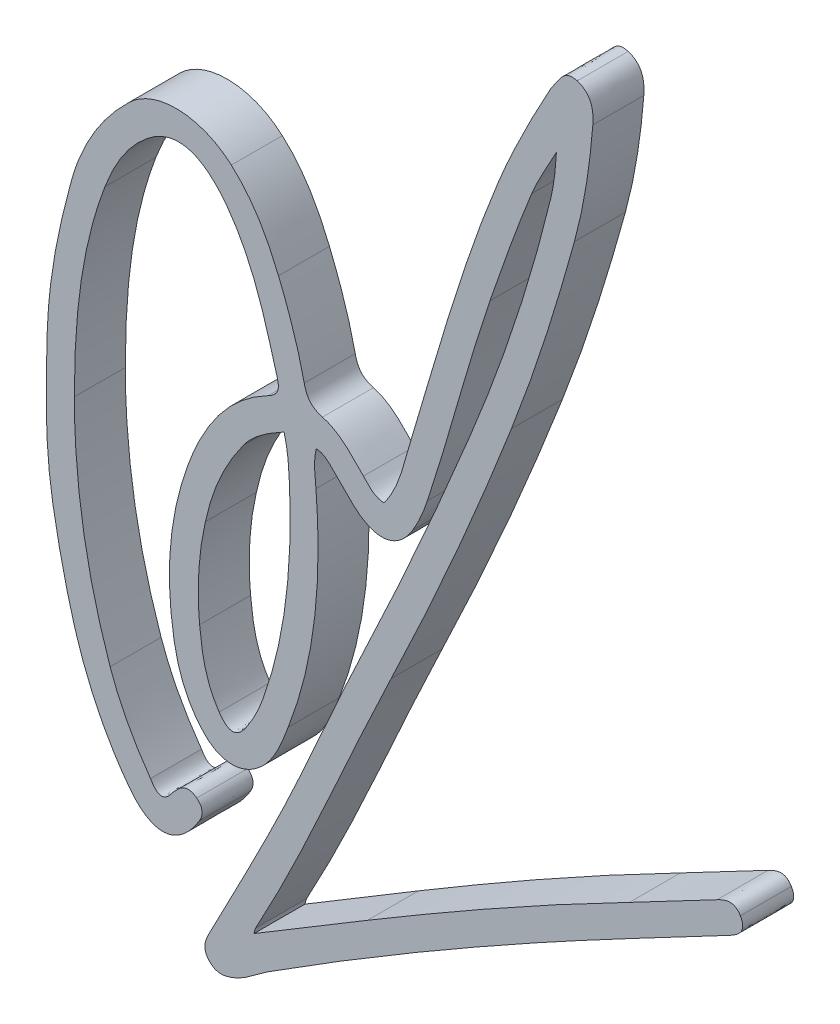
from build123d import *

# Parameters (mm, degrees)
DODANIE_WYCI_GNI_CIE1_DEPTH = 3.5


with BuildPart() as part:
    # Model → Dodanie-wyciągnięcie1 (new body)
    with BuildSketch(Plane.XY):
        with BuildLine():
            add(Edge.make_bspline(
                [(38.811669903, 32.50569122), (39.295239054, 31.660629906), (39.768732734, 31.638400259), (40.29439981, 32.371841755)],
                knots=[0, 0, 0, 0, 1, 1, 1, 1], degree=3))
            add(Edge.make_bspline(
                [(40.29439981, 32.371841755), (40.411704442, 32.535510719), (40.567783555, 32.671892372), (40.709430702, 32.817508213)],
                knots=[0, 0, 0, 0, 1, 1, 1, 1], degree=3))
            add(Edge.make_bspline(
                [(40.709430702, 32.817508213), (41.102371651, 33.221470849), (41.554234567, 33.260332366), (41.985556096, 32.928141348)],
                knots=[0, 0, 0, 0, 1, 1, 1, 1], degree=3))
            add(Edge.make_bspline(
                [(41.985556096, 32.928141348), (42.429208721, 32.586449136), (42.449753361, 32.130096122), (42.163281428, 31.66192691)],
                knots=[0, 0, 0, 0, 1, 1, 1, 1], degree=3))
            add(Edge.make_bspline(
                [(42.163281428, 31.66192691), (40.789667213, 29.417074596), (39.023915712, 29.051663359), (37.366805271, 31.243126003)],
                knots=[0, 0, 0, 0, 1, 1, 1, 1], degree=3))
            add(Edge.make_bspline(
                [(37.366805271, 31.243126003), (35.208718006, 34.09713377), (33.922626139, 37.351833599), (33.089445893, 40.801262973)],
                knots=[0, 0, 0, 0, 1, 1, 1, 1], degree=3))
            add(Edge.make_bspline(
                [(33.089445893, 40.801262973), (32.424452571, 43.554380996), (31.840275934, 46.340756453), (31.712753481, 49.162496518)],
                knots=[0, 0, 0, 0, 1, 1, 1, 1], degree=3))
            add(Edge.make_bspline(
                [(31.712753481, 49.162496518), (31.615875746, 51.306083489), (31.651038625, 53.469917388), (31.726409643, 55.629553004)],
                knots=[0, 0, 0, 0, 1, 1, 1, 1], degree=3))
            add(Edge.make_bspline(
                [(31.726409643, 55.629553004), (31.84270868, 58.962044193), (32.510584776, 62.165272), (33.386759543, 65.348485723)],
                knots=[0, 0, 0, 0, 1, 1, 1, 1], degree=3))
            add(Edge.make_bspline(
                [(33.386759543, 65.348485723), (34.094378297, 67.919326089), (35.418397871, 70.122036959), (37.345940955, 71.972434338)],
                knots=[0, 0, 0, 0, 1, 1, 1, 1], degree=3))
            add(Edge.make_bspline(
                [(37.345940955, 71.972434338), (39.179926699, 73.733019176), (42.269319126, 73.6170026), (44.362777647, 71.749303091)],
                knots=[0, 0, 0, 0, 1, 1, 1, 1], degree=3))
            add(Edge.make_bspline(
                [(44.362777647, 71.749303091), (45.899688685, 70.378127927), (46.841506737, 68.63668193), (47.597789168, 66.786501938)],
                knots=[0, 0, 0, 0, 1, 1, 1, 1], degree=3))
            add(Edge.make_bspline(
                [(47.597789168, 66.786501938), (48.326324907, 65.004208654), (48.962259078, 63.181325328), (49.368247749, 61.290720013)],
                knots=[0, 0, 0, 0, 1, 1, 1, 1], degree=3))
            add(Edge.make_bspline(
                [(49.368247749, 61.290720013), (49.520718311, 60.580696373), (49.823688509, 60.110051099), (50.618454011, 59.894354747)],
                knots=[0, 0, 0, 0, 1, 1, 1, 1], degree=3))
            add(Edge.make_bspline(
                [(50.618454011, 59.894354747), (51.798790845, 59.574013888), (52.60220426, 58.645374112), (53.432104578, 57.795444254)],
                knots=[0, 0, 0, 0, 1, 1, 1, 1], degree=3))
            add(Edge.make_bspline(
                [(53.432104578, 57.795444254), (53.804789449, 57.413760884), (54.134466988, 56.954261344), (54.82645296, 56.907170827)],
                knots=[0, 0, 0, 0, 1, 1, 1, 1], degree=3))
            add(Edge.make_bspline(
                [(54.82645296, 56.907170827), (55.869111137, 58.213121822), (56.187413353, 59.864479325), (56.655545148, 61.432118863)],
                knots=[0, 0, 0, 0, 1, 1, 1, 1], degree=3))
            add(Edge.make_bspline(
                [(56.655545148, 61.432118863), (58.511664352, 67.647816676), (60.229999358, 73.907713081), (62.698798783, 79.922022256)],
                knots=[0, 0, 0, 0, 1, 1, 1, 1], degree=3))
            add(Edge.make_bspline(
                [(62.698798783, 79.922022256), (63.739886849, 82.458224401), (64.984318616, 84.89777535), (66.309408655, 87.29637164)],
                knots=[0, 0, 0, 0, 1, 1, 1, 1], degree=3))
            add(Edge.make_bspline(
                [(66.309408655, 87.29637164), (66.341977323, 87.355323499), (66.38384261, 87.409876567), (66.426303525, 87.462504464)],
                knots=[0, 0, 0, 0, 1, 1, 1, 1], degree=3))
            add(Edge.make_bspline(
                [(66.426303525, 87.462504464), (66.874346807, 88.017837507), (67.165709043, 88.908000516), (68.102971924, 88.626557574)],
                knots=[0, 0, 0, 0, 1, 1, 1, 1], degree=3))
            add(Edge.make_bspline(
                [(68.102971924, 88.626557574), (69.090335394, 88.330070159), (69.248561741, 87.405015751), (69.17899328, 86.547572096)],
                knots=[0, 0, 0, 0, 1, 1, 1, 1], degree=3))
            add(Edge.make_bspline(
                [(69.17899328, 86.547572096), (68.971547687, 83.990646764), (68.597621735, 81.451115276), (67.915068833, 78.974246486)],
                knots=[0, 0, 0, 0, 1, 1, 1, 1], degree=3))
            add(Edge.make_bspline(
                [(67.915068833, 78.974246486), (66.676582582, 74.479971232), (65.280906082, 70.038781425), (63.590572371, 65.686224696)],
                knots=[0, 0, 0, 0, 1, 1, 1, 1], degree=3))
            add(Edge.make_bspline(
                [(63.590572371, 65.686224696), (61.091512775, 59.251262245), (58.342844383, 52.924043852), (55.337089189, 46.716904069)],
                knots=[0, 0, 0, 0, 1, 1, 1, 1], degree=3))
            add(Edge.make_bspline(
                [(55.337089189, 46.716904069), (52.197813559, 40.234022426), (49.497777935, 33.541665699), (46.026984599, 27.218040604)],
                knots=[0, 0, 0, 0, 1, 1, 1, 1], degree=3))
            add(Edge.make_bspline(
                [(46.026984599, 27.218040604), (45.982913308, 27.137742069), (45.974321115, 27.037981764), (45.91934588, 26.839739653)],
                knots=[0, 0, 0, 0, 1, 1, 1, 1], degree=3))
            add(Edge.make_bspline(
                [(45.91934588, 26.839739653), (48.569346191, 28.433788412), (51.134889746, 29.985072238), (53.708212681, 31.523335999)],
                knots=[0, 0, 0, 0, 1, 1, 1, 1], degree=3))
            add(Edge.make_bspline(
                [(53.708212681, 31.523335999), (59.604528458, 35.04797513), (65.576916628, 38.43651202), (71.687839583, 41.578133563)],
                knots=[0, 0, 0, 0, 1, 1, 1, 1], degree=3))
            add(Edge.make_bspline(
                [(71.687839583, 41.578133563), (73.70395372, 42.614623142), (75.70125154, 43.687727765), (77.706778359, 44.744802249)],
                knots=[0, 0, 0, 0, 1, 1, 1, 1], degree=3))
            add(Edge.make_bspline(
                [(77.706778359, 44.744802249), (78.280231226, 45.047056024), (78.912975353, 45.270537653), (79.310297605, 44.586873818)],
                knots=[0, 0, 0, 0, 1, 1, 1, 1], degree=3))
            add(Edge.make_bspline(
                [(79.310297605, 44.586873818), (79.73827698, 43.850440957), (79.24249163, 43.414641937), (78.603913832, 43.075990709)],
                knots=[0, 0, 0, 0, 1, 1, 1, 1], degree=3))
            add(Edge.make_bspline(
                [(78.603913832, 43.075990709), (74.124616553, 40.7005532), (69.619924596, 38.370524453), (65.183938464, 35.916464061)],
                knots=[0, 0, 0, 0, 1, 1, 1, 1], degree=3))
            add(Edge.make_bspline(
                [(65.183938464, 35.916464061), (58.943776936, 32.464310124), (52.79797031, 28.847103386), (46.794909563, 24.992457686)],
                knots=[0, 0, 0, 0, 1, 1, 1, 1], degree=3))
            add(Edge.make_bspline(
                [(46.794909563, 24.992457686), (46.028837172, 24.500550943), (45.372606658, 23.84213903), (44.502293218, 23.506900928)],
                knots=[0, 0, 0, 0, 1, 1, 1, 1], degree=3))
            add(Edge.make_bspline(
                [(44.502293218, 23.506900928), (43.939952124, 23.290289271), (43.382330921, 23.153237357), (42.895450729, 23.626557574)],
                knots=[0, 0, 0, 0, 1, 1, 1, 1], degree=3))
            add(Edge.make_bspline(
                [(42.895450729, 23.626557574), (42.369175618, 24.13816198), (42.506813807, 24.664555038), (42.823058672, 25.273604949)],
                knots=[0, 0, 0, 0, 1, 1, 1, 1], degree=3))
            add(Edge.make_bspline(
                [(42.823058672, 25.273604949), (44.568451604, 28.634997079), (46.340371703, 31.985361422), (47.974172677, 35.401229142)],
                knots=[0, 0, 0, 0, 1, 1, 1, 1], degree=3))
            add(Edge.make_bspline(
                [(47.974172677, 35.401229142), (49.810947855, 39.241452231), (51.447482542, 43.177463678), (53.28480068, 47.017413863)],
                knots=[0, 0, 0, 0, 1, 1, 1, 1], degree=3))
            add(Edge.make_bspline(
                [(53.28480068, 47.017413863), (55.942403248, 52.571733208), (58.427710495, 58.198820209), (60.772025197, 63.890898942)],
                knots=[0, 0, 0, 0, 1, 1, 1, 1], degree=3))
            add(Edge.make_bspline(
                [(60.772025197, 63.890898942), (63.027545561, 69.367383612), (64.899496022, 74.9684073), (66.287855573, 80.726870754)],
                knots=[0, 0, 0, 0, 1, 1, 1, 1], degree=3))
            add(Edge.make_bspline(
                [(66.287855573, 80.726870754), (66.515861261, 81.672569244), (66.625774517, 82.646737153), (66.678655185, 83.667933759)],
                knots=[0, 0, 0, 0, 1, 1, 1, 1], degree=3))
            add(Edge.make_bspline(
                [(66.678655185, 83.667933759), (66.106375479, 82.567698408), (65.443067163, 81.504265798), (64.980321859, 80.35974665)],
                knots=[0, 0, 0, 0, 1, 1, 1, 1], degree=3))
            add(Edge.make_bspline(
                [(64.980321859, 80.35974665), (63.942578794, 77.793102939), (63.012409171, 75.186620181), (62.116260584, 72.562491011)],
                knots=[0, 0, 0, 0, 1, 1, 1, 1], degree=3))
            add(Edge.make_bspline(
                [(62.116260584, 72.562491011), (60.531514341, 67.921988424), (59.355738983, 63.1637688), (57.818362668, 58.514168477)],
                knots=[0, 0, 0, 0, 1, 1, 1, 1], degree=3))
            add(Edge.make_bspline(
                [(57.818362668, 58.514168477), (57.564974502, 57.747822979), (57.245716717, 56.983373368), (56.83033524, 56.294344598)],
                knots=[0, 0, 0, 0, 1, 1, 1, 1], degree=3))
            add(Edge.make_bspline(
                [(56.83033524, 56.294344598), (55.753029284, 54.507334677), (54.237131622, 54.32604411), (52.712949037, 55.749252965)],
                knots=[0, 0, 0, 0, 1, 1, 1, 1], degree=3))
            add(Edge.make_bspline(
                [(52.712949037, 55.749252965), (52.218026323, 56.211383727), (51.752305312, 56.704854481), (51.275081882, 57.185832674)],
                knots=[0, 0, 0, 0, 1, 1, 1, 1], degree=3))
            add(Edge.make_bspline(
                [(51.275081882, 57.185832674), (50.99018616, 57.472971615), (50.708455673, 57.762934356), (50.197533729, 57.811936418)],
                knots=[0, 0, 0, 0, 1, 1, 1, 1], degree=3))
            add(Edge.make_bspline(
                [(50.197533729, 57.811936418), (49.986401904, 56.998934772), (50.107436083, 56.184965152), (50.170019879, 55.415879636)],
                knots=[0, 0, 0, 0, 1, 1, 1, 1], degree=3))
            add(Edge.make_bspline(
                [(50.170019879, 55.415879636), (50.592085054, 50.229252369), (50.156031636, 45.15481574), (48.261888742, 40.275186338)],
                knots=[0, 0, 0, 0, 1, 1, 1, 1], degree=3))
            add(Edge.make_bspline(
                [(48.261888742, 40.275186338), (47.756006365, 38.971947297), (47.270060186, 37.604923644), (46.049645564, 36.716991652)],
                knots=[0, 0, 0, 0, 1, 1, 1, 1], degree=3))
            add(Edge.make_bspline(
                [(46.049645564, 36.716991652), (44.892953328, 35.8754305), (43.573507635, 35.948927187), (42.557041495, 36.970926031)],
                knots=[0, 0, 0, 0, 1, 1, 1, 1], degree=3))
            add(Edge.make_bspline(
                [(42.557041495, 36.970926031), (41.312733978, 38.22200408), (40.724200848, 39.829606713), (40.436053261, 41.499585109)],
                knots=[0, 0, 0, 0, 1, 1, 1, 1], degree=3))
            add(Edge.make_bspline(
                [(40.436053261, 41.499585109), (39.794807027, 45.215968927), (40.084378715, 48.883896694), (41.389547806, 52.443515685)],
                knots=[0, 0, 0, 0, 1, 1, 1, 1], degree=3))
            add(Edge.make_bspline(
                [(41.389547806, 52.443515685), (42.453451998, 55.345129068), (44.046449, 57.837517167), (46.892140934, 59.307807387)],
                knots=[0, 0, 0, 0, 1, 1, 1, 1], degree=3))
            add(Edge.make_bspline(
                [(46.892140934, 59.307807387), (47.487826294, 59.615578208), (47.718677542, 59.970591452), (47.522045806, 60.663471173)],
                knots=[0, 0, 0, 0, 1, 1, 1, 1], degree=3))
            add(Edge.make_bspline(
                [(47.522045806, 60.663471173), (46.673422103, 63.65376115), (45.921154934, 66.680492303), (44.015577744, 69.232957023)],
                knots=[0, 0, 0, 0, 1, 1, 1, 1], degree=3))
            add(Edge.make_bspline(
                [(44.015577744, 69.232957023), (43.694054574, 69.663636151), (43.313885595, 70.06396502), (42.905712271, 70.414072506)],
                knots=[0, 0, 0, 0, 1, 1, 1, 1], degree=3))
            add(Edge.make_bspline(
                [(42.905712271, 70.414072506), (41.508738971, 71.612319708), (40.027020556, 71.610380303), (38.592284064, 70.450963707)],
                knots=[0, 0, 0, 0, 1, 1, 1, 1], degree=3))
            add(Edge.make_bspline(
                [(38.592284064, 70.450963707), (37.176543862, 69.306900686), (36.303071694, 67.763194307), (35.68110421, 66.120515628)],
                knots=[0, 0, 0, 0, 1, 1, 1, 1], degree=3))
            add(Edge.make_bspline(
                [(35.68110421, 66.120515628), (34.031689163, 61.764244806), (33.580173579, 57.222608979), (33.584561186, 52.578894793)],
                knots=[0, 0, 0, 0, 1, 1, 1, 1], degree=3))
            add(Edge.make_bspline(
                [(33.584561186, 52.578894793), (33.589376857, 47.484223845), (34.374870754, 42.555753845), (36.041119399, 37.760258067)],
                knots=[0, 0, 0, 0, 1, 1, 1, 1], degree=3))
            add(Edge.make_bspline(
                [(36.041119399, 37.760258067), (36.687938601, 35.898690348), (37.620748801, 34.170345148), (38.811669903, 32.50569122)],
                knots=[0, 0, 0, 0, 1, 1, 1, 1], degree=3))
        make_face()
        with BuildLine():
            add(Edge.make_bspline(
                [(42.580388176, 49.654192177), (42.09410707, 47.56951192), (41.984923049, 45.450404119), (42.18460187, 43.333449856)],
                knots=[0, 0, 0, 0, 1, 1, 1, 1], degree=3))
            add(Edge.make_bspline(
                [(42.18460187, 43.333449856), (42.333404502, 41.755896311), (42.589070253, 40.165719856), (43.525619557, 38.813317492)],
                knots=[0, 0, 0, 0, 1, 1, 1, 1], degree=3))
            add(Edge.make_bspline(
                [(43.525619557, 38.813317492), (44.181375235, 37.866385649), (44.750120819, 37.897173326), (45.395490908, 38.846109648)],
                knots=[0, 0, 0, 0, 1, 1, 1, 1], degree=3))
            add(Edge.make_bspline(
                [(45.395490908, 38.846109648), (45.873726034, 39.549297277), (46.248598405, 40.300804301), (46.535777813, 41.102939421)],
                knots=[0, 0, 0, 0, 1, 1, 1, 1], degree=3))
            add(Edge.make_bspline(
                [(46.535777813, 41.102939421), (48.121734024, 45.532787865), (48.556527855, 50.112115302), (48.354530981, 54.780107133)],
                knots=[0, 0, 0, 0, 1, 1, 1, 1], degree=3))
            add(Edge.make_bspline(
                [(48.354530981, 54.780107133), (48.313878916, 55.719476984), (48.259940186, 56.650087076), (47.983056483, 57.689307318)],
                knots=[0, 0, 0, 0, 1, 1, 1, 1], degree=3))
            add(Edge.make_bspline(
                [(47.983056483, 57.689307318), (46.869700203, 57.092979556), (45.900849034, 56.478319462), (45.185876321, 55.500584487)],
                knots=[0, 0, 0, 0, 1, 1, 1, 1], degree=3))
            add(Edge.make_bspline(
                [(45.185876321, 55.500584487), (43.931360134, 53.785011054), (43.055045661, 51.903909984), (42.580388176, 49.654192177)],
                knots=[0, 0, 0, 0, 1, 1, 1, 1], degree=3))
        make_face(mode=Mode.SUBTRACT)
    extrude(amount=DODANIE_WYCI_GNI_CIE1_DEPTH)


solid = part.part
